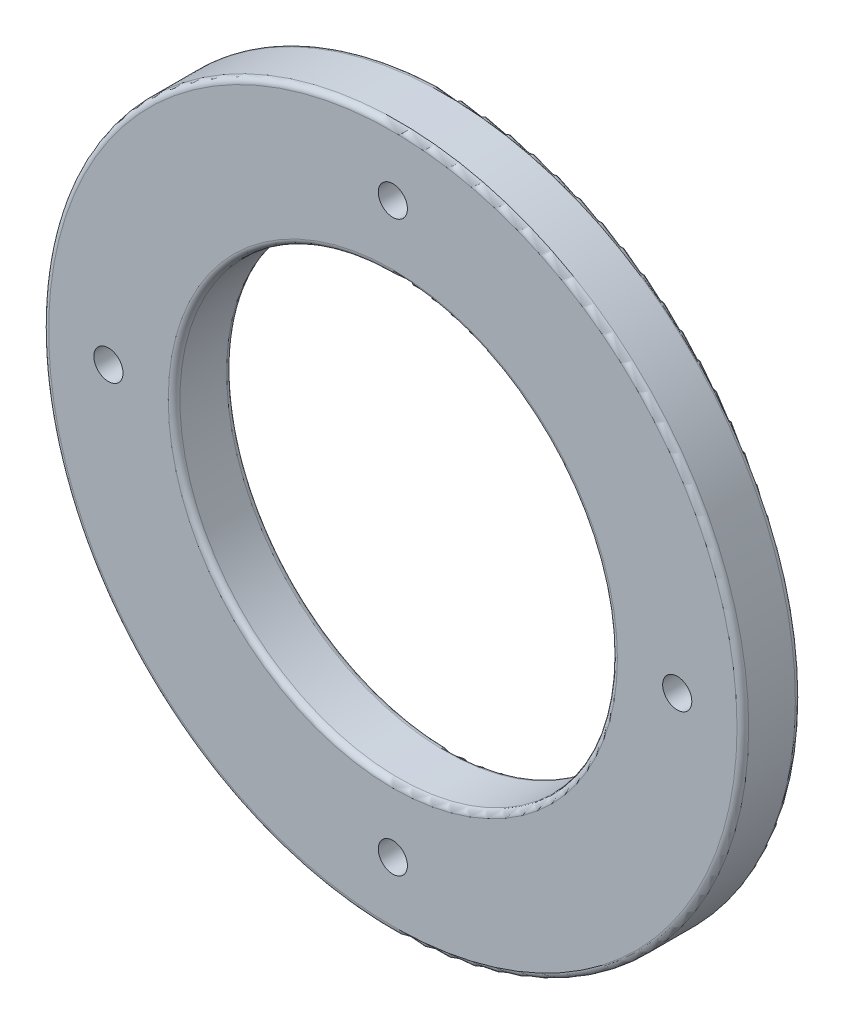
from build123d import *

# Parameters (mm, degrees)
SKETCH1_R           = 76.2
BOSS_EXTRUDE1_DEPTH = 12.7
FILLET1_R           = 1.27
SKETCH2_R           = 47.625
SKETCH2_R_2         = 3.175
CUT_EXTRUDE1_DEPTH  = 12.7
FILLET2_R           = 1.27


with BuildPart() as part:
    # Sketch1 → Boss-Extrude1 (new body)
    with BuildSketch(Plane.XY):
        Circle(SKETCH1_R)
    extrude(amount=BOSS_EXTRUDE1_DEPTH)

    # Fillet1
    fillet1_edges = [part.edges().sort_by_distance(p)[0] for p in [
        (-76.2, 0, 0),
        (-76.2, 0, 12.7),
    ]]
    fillet(fillet1_edges, radius=FILLET1_R)

    # Sketch2 → Cut-Extrude1 (cut)
    with BuildSketch(Plane.XY.offset(12.7)):
        Circle(SKETCH2_R)
        with Locations((0, 61.9125)):
            Circle(SKETCH2_R_2)
        with Locations((61.9125, 0)):
            Circle(SKETCH2_R_2)
        with Locations((0, -61.9125)):
            Circle(SKETCH2_R_2)
        with Locations((-61.9125, 0)):
            Circle(SKETCH2_R_2)
    extrude(amount=-CUT_EXTRUDE1_DEPTH, mode=Mode.SUBTRACT)

    # Fillet2
    fillet2_edges = [part.edges().sort_by_distance(p)[0] for p in [
        (-47.625, 0, 0),
        (-47.625, 0, 12.7),
    ]]
    fillet(fillet2_edges, radius=FILLET2_R)


solid = part.part
